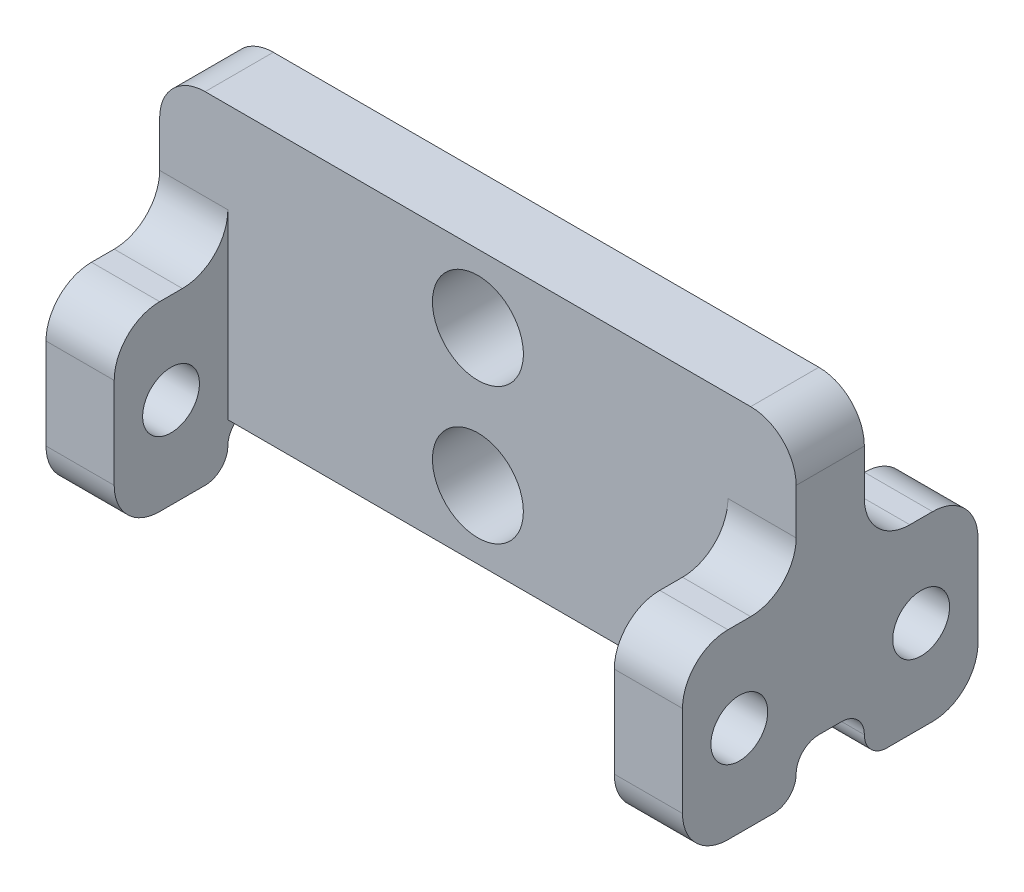
from build123d import *

# Parameters (mm, degrees)
SKETCH_1_W          = 28
SKETCH_1_H          = 12
SKETCH_1_R          = 2
EXTRUDE_1_DEPTH     = 1.5
SKETCH_2_W          = 5
SKETCH_2_H          = 8
EXTRUDE_2_DEPTH     = 3
SKETCH_4_R          = 1.25
CUT_EXTRUDE_2_DEPTH = 5
FILLET_1_R          = 2
FILLET_2_R          = 1


with BuildPart() as part:
    # 草图1 → 凸台-拉伸1 (new, symmetric)
    with BuildSketch(Plane.XY):
        with Locations((0, 6)):
            Rectangle(SKETCH_1_W, SKETCH_1_H)
        with Locations((0, 3)):
            Circle(SKETCH_1_R, mode=Mode.SUBTRACT)
        with Locations(Location((0, 9, 0), (0, 0, 180))):
            Circle(SKETCH_1_R, mode=Mode.SUBTRACT)
    extrude(amount=EXTRUDE_1_DEPTH, both=True)

    # 草图2 → 凸台-拉伸2 (add)
    with BuildSketch(Plane.ZY.offset(14)):
        with Locations((4, 2)):
            Rectangle(SKETCH_2_W, SKETCH_2_H)
        with Locations((-4, 2)):
            Rectangle(SKETCH_2_W, SKETCH_2_H)
    extrude_2 = extrude(amount=-EXTRUDE_2_DEPTH)

    # 草图4 → 切除-拉伸2 (cut)
    with BuildSketch(Plane.ZY.offset(14)):
        with Locations((4, 2)):
            Circle(SKETCH_4_R)
        with Locations((-4, 2)):
            Circle(SKETCH_4_R)
    cut_extrude_2 = extrude(amount=-CUT_EXTRUDE_2_DEPTH, mode=Mode.SUBTRACT)

    # 镜向1: 凸台-拉伸2, 切除-拉伸2 across plane
    add(extrude_2.mirror(Plane(origin=(0, 0, 0), x_dir=(0, 0, 1), z_dir=(1, 0, 0))))
    add(cut_extrude_2.mirror(Plane(origin=(0, 0, 0), x_dir=(0, 0, 1), z_dir=(1, 0, 0))), mode=Mode.SUBTRACT)

    # 圆角1
    fillet_1_edges = [part.edges().sort_by_distance(p)[0] for p in [
        (-12.5, 6, 1.5),
        (-12.5, 6, 6.5),
        (-12.5, -2, 6.5),
        (-12.5, 6, -6.5),
        (-12.5, 6, -1.5),
        (-12.5, -2, -6.5),
        (12.5, 6, 1.5),
        (12.5, -2, 6.5),
        (12.5, 6, 6.5),
        (-14, 12, 0),
        (12.5, 6, -1.5),
        (14, 12, 0),
        (12.5, 6, -6.5),
        (12.5, -2, -6.5),
    ]]
    fillet(fillet_1_edges, radius=FILLET_1_R)

    # 圆角2
    fillet_2_edges = [part.edges().sort_by_distance(p)[0] for p in [
        (12.5, 0, -1.5),
        (12.5, 0, 1.5),
        (-12.5, 0, 1.5),
        (-12.5, 0, -1.5),
    ]]
    fillet(fillet_2_edges, radius=FILLET_2_R)
    fillet_2_2_edges = [part.edges().sort_by_distance(p)[0] for p in [
        (12.5, -2, -1.5),
        (12.5, -2, 1.5),
        (-12.5, -2, 1.5),
        (-12.5, -2, -1.5),
    ]]
    fillet(fillet_2_2_edges, radius=FILLET_2_R - 0.0001)  # a hair under: the kernel refuses the full size


solid = part.part
